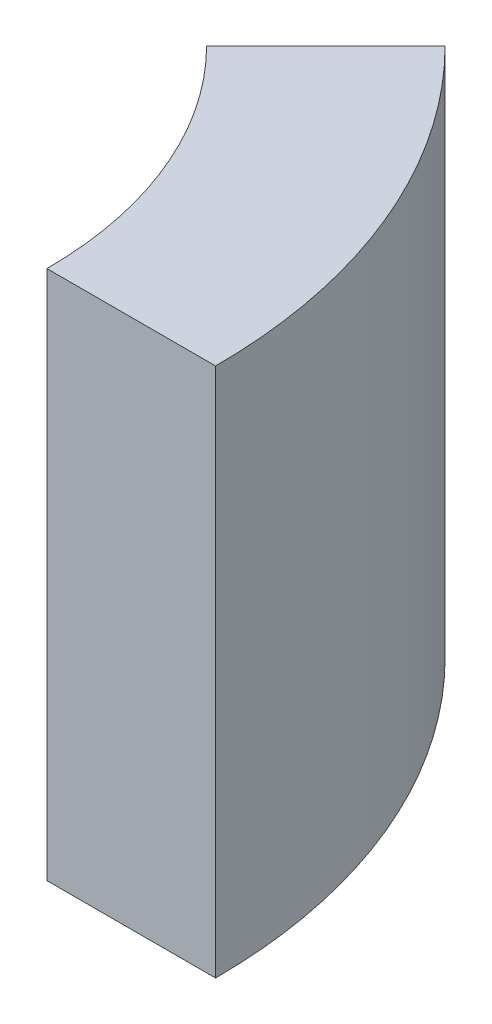
from build123d import *

# Parameters (mm, degrees)
BOSS_EXTRUDE1_DEPTH = 22


with BuildPart() as part:
    # Sketch1 → Boss-Extrude1 (new body)
    with BuildSketch(Plane(origin=(0, 0, 0), x_dir=(1, 0, 0), z_dir=(0, 1, 0))):
        with BuildLine():
            Line((11.313708499, 11.313708499), (16.263455967, 16.263455967))
            ThreePointArc((16.263455967, 16.263455967), (21.249229248, 8.801718944), (23, 0))
            Line((23, 0), (16, 0))
            ThreePointArc((16, 0), (14.78207252, 6.122934918), (11.313708499, 11.313708499))
        make_face()
    extrude(amount=BOSS_EXTRUDE1_DEPTH)


solid = part.part
